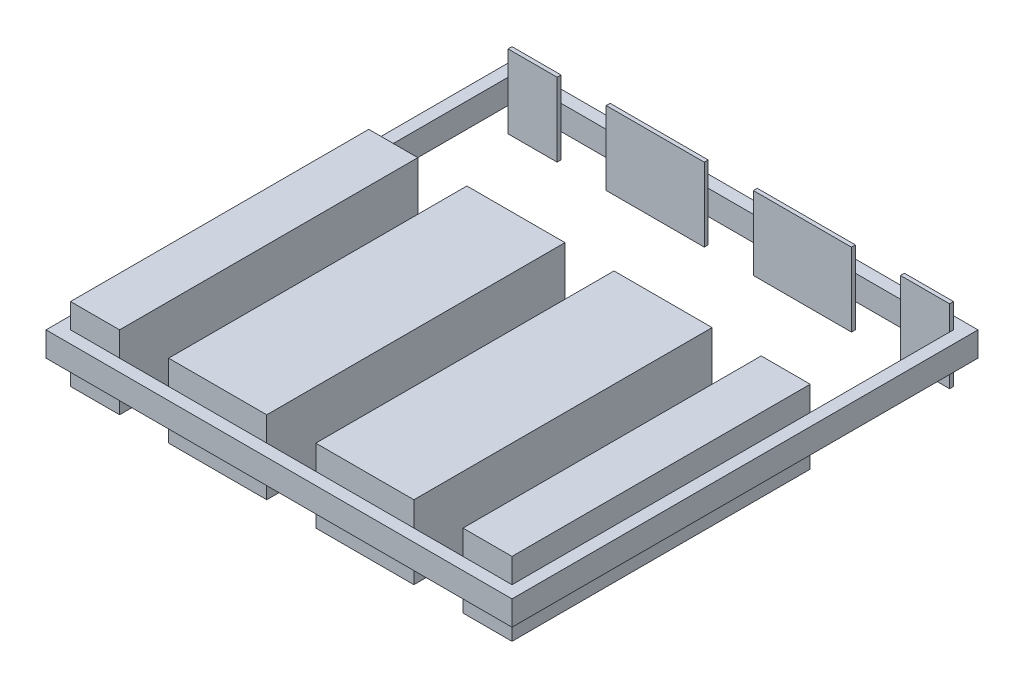
from build123d import *

# Parameters (mm, degrees)
SKETCH1_W           = 180
SKETCH1_H           = 30
BOSS_EXTRUDE1_DEPTH = 90
SKETCH2_W           = 20
SKETCH2_H           = 30
CUT_EXTRUDE1_DEPTH  = 90
CUT_EXTRUDE2_START  = -31.6
SKETCH3_OUTSIDE_W   = 233.264
SKETCH3_OUTSIDE_H   = 83.264
SKETCH3_OUTSIDE_W_2 = 16.8
SKETCH3_OUTSIDE_H_2 = 26.8
CUT_EXTRUDE2_DEPTH  = 56.8
SKETCH4_W           = 16.8
SKETCH4_H           = 26.8
CUT_EXTRUDE3_DEPTH  = 28.4
CUT_EXTRUDE4_START  = 31.6
SKETCH5_W           = 16.8
SKETCH5_H           = 26.8
CUT_EXTRUDE4_DEPTH  = 56.8
BOSS_EXTRUDE2_START = -31.6
SKETCH6_W           = 1.6
SKETCH6_H           = 23.8
BOSS_EXTRUDE2_DEPTH = 56.8
SKETCH7_W           = 1.6
SKETCH7_H           = 23.8
BOSS_EXTRUDE3_DEPTH = 28.4
BOSS_EXTRUDE4_START = 31.6
SKETCH8_W           = 1.6
SKETCH8_H           = 23.8
BOSS_EXTRUDE4_DEPTH = 56.8
CUT_EXTRUDE5_START  = -31.6
SKETCH9_OUTSIDE_W   = 233.264
SKETCH9_OUTSIDE_H   = 83.264
SKETCH9_OUTSIDE_W_2 = 1.6
SKETCH9_OUTSIDE_H_2 = 3
CUT_EXTRUDE5_DEPTH  = 56.8
SKETCH10_W          = 1.6
SKETCH10_H          = 3
CUT_EXTRUDE6_DEPTH  = 28.4
CUT_EXTRUDE7_START  = 31.6
SKETCH11_W          = 1.6
SKETCH11_H          = 3
CUT_EXTRUDE7_DEPTH  = 56.8
SKETCH12_W          = 190
SKETCH12_H          = 190
SKETCH12_W_2        = 180
SKETCH12_H_2        = 180
BOSS_EXTRUDE5_DEPTH = 5


with BuildPart() as part:
    # Sketch1 → Boss-Extrude1 (new, symmetric)
    with BuildSketch(Plane.XY):
        Rectangle(SKETCH1_W, SKETCH1_H)
    extrude(amount=BOSS_EXTRUDE1_DEPTH, both=True)

    # Sketch2 → Cut-Extrude1 (cut, symmetric)
    with BuildSketch(Plane.XY):
        with Locations((-60, 0)):
            Rectangle(SKETCH2_W, SKETCH2_H)
        Rectangle(SKETCH2_W, SKETCH2_H)
        with Locations((60, 0)):
            Rectangle(SKETCH2_W, SKETCH2_H)
    extrude(amount=CUT_EXTRUDE1_DEPTH, both=True, mode=Mode.SUBTRACT)


with BuildPart() as cut_extrude1_piece_1:
    # of the separate pieces the step leaves, piece 1, a body of its own (cut_extrude1_pieces)
    add(part.part.solids().sort_by_distance((-50, -15, -90))[0])


with BuildPart() as cut_extrude1_piece_2:
    # of the separate pieces the step leaves, piece 2, a body of its own (cut_extrude1_pieces)
    add(part.part.solids().sort_by_distance((10, -15, -90))[0])


with BuildPart() as cut_extrude1_piece_3:
    # of the separate pieces the step leaves, piece 3, a body of its own (cut_extrude1_pieces)
    add(part.part.solids().sort_by_distance((-90, -15, 90))[0])


with BuildPart() as cut_extrude1_piece_4:
    # of the separate pieces the step leaves, piece 4, a body of its own (cut_extrude1_pieces)
    add(part.part.solids().sort_by_distance((70, -15, -90))[0])


with BuildPart() as cut_extrude2_tool:
    # Sketch3 outside → Cut-Extrude2 (new body)
    with BuildSketch(Plane.XY.offset(CUT_EXTRUDE2_START)):
        Rectangle(SKETCH3_OUTSIDE_W, SKETCH3_OUTSIDE_H)
        with Locations((-80, 0)):
            Rectangle(SKETCH3_OUTSIDE_W_2, SKETCH3_OUTSIDE_H_2, mode=Mode.SUBTRACT)
        with Locations((-40, 0)):
            Rectangle(SKETCH3_OUTSIDE_W_2, SKETCH3_OUTSIDE_H_2, mode=Mode.SUBTRACT)
        with Locations((-20, 0)):
            Rectangle(SKETCH3_OUTSIDE_W_2, SKETCH3_OUTSIDE_H_2, mode=Mode.SUBTRACT)
        with Locations((20, 0)):
            Rectangle(SKETCH3_OUTSIDE_W_2, SKETCH3_OUTSIDE_H_2, mode=Mode.SUBTRACT)
        with Locations((40, 0)):
            Rectangle(SKETCH3_OUTSIDE_W_2, SKETCH3_OUTSIDE_H_2, mode=Mode.SUBTRACT)
        with Locations((80, 0)):
            Rectangle(SKETCH3_OUTSIDE_W_2, SKETCH3_OUTSIDE_H_2, mode=Mode.SUBTRACT)
    extrude(amount=-CUT_EXTRUDE2_DEPTH)


with BuildPart() as cut_extrude1_piece_1_1:
    add(cut_extrude1_piece_1.part)

    # Cut-Extrude2: cut by cut_extrude2_tool
    add(cut_extrude2_tool.part, mode=Mode.SUBTRACT)


with BuildPart() as cut_extrude1_piece_2_1:
    add(cut_extrude1_piece_2.part)

    # Cut-Extrude2: cut by cut_extrude2_tool
    add(cut_extrude2_tool.part, mode=Mode.SUBTRACT)


with BuildPart() as cut_extrude1_piece_3_1:
    add(cut_extrude1_piece_3.part)

    # Cut-Extrude2: cut by cut_extrude2_tool
    add(cut_extrude2_tool.part, mode=Mode.SUBTRACT)


with BuildPart() as cut_extrude1_piece_4_1:
    add(cut_extrude1_piece_4.part)

    # Cut-Extrude2: cut by cut_extrude2_tool
    add(cut_extrude2_tool.part, mode=Mode.SUBTRACT)


with BuildPart() as cut_extrude3_tool:
    # Sketch4 → Cut-Extrude3 (new, symmetric)
    with BuildSketch(Plane.XY):
        with Locations((-80, 0)):
            Rectangle(SKETCH4_W, SKETCH4_H)
        with Locations((-40, 0)):
            Rectangle(SKETCH4_W, SKETCH4_H)
        with Locations((-20, 0)):
            Rectangle(SKETCH4_W, SKETCH4_H)
        with Locations((20, 0)):
            Rectangle(SKETCH4_W, SKETCH4_H)
        with Locations((40, 0)):
            Rectangle(SKETCH4_W, SKETCH4_H)
        with Locations((80, 0)):
            Rectangle(SKETCH4_W, SKETCH4_H)
    extrude(amount=CUT_EXTRUDE3_DEPTH, both=True)


with BuildPart() as cut_extrude1_piece_1_2:
    add(cut_extrude1_piece_1_1.part)

    # Cut-Extrude3: cut by cut_extrude3_tool
    add(cut_extrude3_tool.part, mode=Mode.SUBTRACT)


with BuildPart() as cut_extrude1_piece_2_2:
    add(cut_extrude1_piece_2_1.part)

    # Cut-Extrude3: cut by cut_extrude3_tool
    add(cut_extrude3_tool.part, mode=Mode.SUBTRACT)


with BuildPart() as cut_extrude1_piece_3_2:
    add(cut_extrude1_piece_3_1.part)

    # Cut-Extrude3: cut by cut_extrude3_tool
    add(cut_extrude3_tool.part, mode=Mode.SUBTRACT)


with BuildPart() as cut_extrude1_piece_4_2:
    add(cut_extrude1_piece_4_1.part)

    # Cut-Extrude3: cut by cut_extrude3_tool
    add(cut_extrude3_tool.part, mode=Mode.SUBTRACT)


with BuildPart() as cut_extrude4_tool:
    # Sketch5 → Cut-Extrude4 (new body)
    with BuildSketch(Plane.XY.offset(CUT_EXTRUDE4_START)):
        with Locations((-80, 0)):
            Rectangle(SKETCH5_W, SKETCH5_H)
        with Locations((-40, 0)):
            Rectangle(SKETCH5_W, SKETCH5_H)
        with Locations((-20, 0)):
            Rectangle(SKETCH5_W, SKETCH5_H)
        with Locations((20, 0)):
            Rectangle(SKETCH5_W, SKETCH5_H)
        with Locations((40, 0)):
            Rectangle(SKETCH5_W, SKETCH5_H)
        with Locations((80, 0)):
            Rectangle(SKETCH5_W, SKETCH5_H)
    extrude(amount=-CUT_EXTRUDE4_DEPTH)


with BuildPart() as cut_extrude1_piece_1_3:
    add(cut_extrude1_piece_1_2.part)

    # Cut-Extrude4: cut by cut_extrude4_tool
    add(cut_extrude4_tool.part, mode=Mode.SUBTRACT)



with BuildPart() as cut_extrude1_piece_2_3:
    add(cut_extrude1_piece_2_2.part)

    # Cut-Extrude4: cut by cut_extrude4_tool
    add(cut_extrude4_tool.part, mode=Mode.SUBTRACT)


with BuildPart() as cut_extrude1_piece_3_3:
    add(cut_extrude1_piece_3_2.part)

    # Cut-Extrude4: cut by cut_extrude4_tool
    add(cut_extrude4_tool.part, mode=Mode.SUBTRACT)


with BuildPart() as cut_extrude1_piece_4_3:
    add(cut_extrude1_piece_4_2.part)

    # Cut-Extrude4: cut by cut_extrude4_tool
    add(cut_extrude4_tool.part, mode=Mode.SUBTRACT)


with BuildPart() as cut_extrude1_piece_1_4:
    add(cut_extrude1_piece_1_3.part)

    add(cut_extrude1_piece_2_3.part)  # Boss-Extrude2 merges Cut-Extrude1 piece 2

    add(cut_extrude1_piece_3_3.part)  # Boss-Extrude2 merges Cut-Extrude1 piece 3

    add(cut_extrude1_piece_4_3.part)  # Boss-Extrude2 merges Cut-Extrude1 piece 4
    # Sketch6 → Boss-Extrude2 (add)
    with BuildSketch(Plane.XY.offset(BOSS_EXTRUDE2_START)):
        with Locations((-75.4, -1.5)):
            Rectangle(SKETCH6_W, SKETCH6_H)
        with Locations((-80, 1.5)):
            Rectangle(SKETCH6_W, SKETCH6_H)
        with Locations((-84.6, -1.5)):
            Rectangle(SKETCH6_W, SKETCH6_H)
        with Locations((-44.6, -1.5)):
            Rectangle(SKETCH6_W, SKETCH6_H)
        with Locations((-40, 1.5)):
            Rectangle(SKETCH6_W, SKETCH6_H)
        with Locations((-35.4, -1.5)):
            Rectangle(SKETCH6_W, SKETCH6_H)
        with Locations((-15.4, -1.5)):
            Rectangle(SKETCH6_W, SKETCH6_H)
        with Locations((-20, 1.5)):
            Rectangle(SKETCH6_W, SKETCH6_H)
        with Locations((-24.6, -1.5)):
            Rectangle(SKETCH6_W, SKETCH6_H)
        with Locations((15.4, -1.5)):
            Rectangle(SKETCH6_W, SKETCH6_H)
        with Locations((20, 1.5)):
            Rectangle(SKETCH6_W, SKETCH6_H)
        with Locations((24.6, -1.5)):
            Rectangle(SKETCH6_W, SKETCH6_H)
        with Locations((44.6, -1.5)):
            Rectangle(SKETCH6_W, SKETCH6_H)
        with Locations((40, 1.5)):
            Rectangle(SKETCH6_W, SKETCH6_H)
        with Locations((35.4, -1.5)):
            Rectangle(SKETCH6_W, SKETCH6_H)
        with Locations((75.4, -1.5)):
            Rectangle(SKETCH6_W, SKETCH6_H)
        with Locations((80, 1.5)):
            Rectangle(SKETCH6_W, SKETCH6_H)
        with Locations((84.6, -1.5)):
            Rectangle(SKETCH6_W, SKETCH6_H)
    extrude(amount=BOSS_EXTRUDE2_DEPTH)

    # Sketch7 → Boss-Extrude3 (add, symmetric)
    with BuildSketch(Plane.XY):
        with Locations((-75.4, -1.5)):
            Rectangle(SKETCH7_W, SKETCH7_H)
        with Locations((-80, 1.5)):
            Rectangle(SKETCH7_W, SKETCH7_H)
        with Locations((-84.6, -1.5)):
            Rectangle(SKETCH7_W, SKETCH7_H)
        with Locations((-44.6, -1.5)):
            Rectangle(SKETCH7_W, SKETCH7_H)
        with Locations((-40, 1.5)):
            Rectangle(SKETCH7_W, SKETCH7_H)
        with Locations((-35.4, -1.5)):
            Rectangle(SKETCH7_W, SKETCH7_H)
        with Locations((-15.4, -1.5)):
            Rectangle(SKETCH7_W, SKETCH7_H)
        with Locations((-20, 1.5)):
            Rectangle(SKETCH7_W, SKETCH7_H)
        with Locations((-24.6, -1.5)):
            Rectangle(SKETCH7_W, SKETCH7_H)
        with Locations((15.4, -1.5)):
            Rectangle(SKETCH7_W, SKETCH7_H)
        with Locations((20, 1.5)):
            Rectangle(SKETCH7_W, SKETCH7_H)
        with Locations((24.6, -1.5)):
            Rectangle(SKETCH7_W, SKETCH7_H)
        with Locations((44.6, -1.5)):
            Rectangle(SKETCH7_W, SKETCH7_H)
        with Locations((40, 1.5)):
            Rectangle(SKETCH7_W, SKETCH7_H)
        with Locations((35.4, -1.5)):
            Rectangle(SKETCH7_W, SKETCH7_H)
        with Locations((75.4, -1.5)):
            Rectangle(SKETCH7_W, SKETCH7_H)
        with Locations((80, 1.5)):
            Rectangle(SKETCH7_W, SKETCH7_H)
        with Locations((84.6, -1.5)):
            Rectangle(SKETCH7_W, SKETCH7_H)
    extrude(amount=BOSS_EXTRUDE3_DEPTH, both=True)

    # Sketch8 → Boss-Extrude4 (add)
    with BuildSketch(Plane.XY.offset(BOSS_EXTRUDE4_START)):
        with Locations((-75.4, -1.5)):
            Rectangle(SKETCH8_W, SKETCH8_H)
        with Locations((-80, 1.5)):
            Rectangle(SKETCH8_W, SKETCH8_H)
        with Locations((-84.6, -1.5)):
            Rectangle(SKETCH8_W, SKETCH8_H)
        with Locations((-44.6, -1.5)):
            Rectangle(SKETCH8_W, SKETCH8_H)
        with Locations((-40, 1.5)):
            Rectangle(SKETCH8_W, SKETCH8_H)
        with Locations((-35.4, -1.5)):
            Rectangle(SKETCH8_W, SKETCH8_H)
        with Locations((-15.4, -1.5)):
            Rectangle(SKETCH8_W, SKETCH8_H)
        with Locations((-20, 1.5)):
            Rectangle(SKETCH8_W, SKETCH8_H)
        with Locations((-24.6, -1.5)):
            Rectangle(SKETCH8_W, SKETCH8_H)
        with Locations((15.4, -1.5)):
            Rectangle(SKETCH8_W, SKETCH8_H)
        with Locations((20, 1.5)):
            Rectangle(SKETCH8_W, SKETCH8_H)
        with Locations((24.6, -1.5)):
            Rectangle(SKETCH8_W, SKETCH8_H)
        with Locations((44.6, -1.5)):
            Rectangle(SKETCH8_W, SKETCH8_H)
        with Locations((40, 1.5)):
            Rectangle(SKETCH8_W, SKETCH8_H)
        with Locations((35.4, -1.5)):
            Rectangle(SKETCH8_W, SKETCH8_H)
        with Locations((75.4, -1.5)):
            Rectangle(SKETCH8_W, SKETCH8_H)
        with Locations((80, 1.5)):
            Rectangle(SKETCH8_W, SKETCH8_H)
        with Locations((84.6, -1.5)):
            Rectangle(SKETCH8_W, SKETCH8_H)
    extrude(amount=BOSS_EXTRUDE4_DEPTH)

    # Sketch9 outside → Cut-Extrude5 (cut)
    with BuildSketch(Plane.XY.offset(CUT_EXTRUDE5_START)):
        Rectangle(SKETCH9_OUTSIDE_W, SKETCH9_OUTSIDE_H)
        with Locations((-70.8, -11.9)):
            Rectangle(SKETCH9_OUTSIDE_W_2, SKETCH9_OUTSIDE_H_2, mode=Mode.SUBTRACT)
        with Locations((-49.2, -11.9)):
            Rectangle(SKETCH9_OUTSIDE_W_2, SKETCH9_OUTSIDE_H_2, mode=Mode.SUBTRACT)
        with Locations((-10.8, -11.9)):
            Rectangle(SKETCH9_OUTSIDE_W_2, SKETCH9_OUTSIDE_H_2, mode=Mode.SUBTRACT)
        with Locations((10.8, -11.9)):
            Rectangle(SKETCH9_OUTSIDE_W_2, SKETCH9_OUTSIDE_H_2, mode=Mode.SUBTRACT)
        with Locations((49.2, -11.9)):
            Rectangle(SKETCH9_OUTSIDE_W_2, SKETCH9_OUTSIDE_H_2, mode=Mode.SUBTRACT)
        with Locations((70.8, -11.9)):
            Rectangle(SKETCH9_OUTSIDE_W_2, SKETCH9_OUTSIDE_H_2, mode=Mode.SUBTRACT)
    extrude(amount=-CUT_EXTRUDE5_DEPTH, mode=Mode.SUBTRACT)

    # Sketch10 → Cut-Extrude6 (cut, symmetric)
    with BuildSketch(Plane.XY):
        with Locations((-70.8, -11.9)):
            Rectangle(SKETCH10_W, SKETCH10_H)
        with Locations((-49.2, -11.9)):
            Rectangle(SKETCH10_W, SKETCH10_H)
        with Locations((-10.8, -11.9)):
            Rectangle(SKETCH10_W, SKETCH10_H)
        with Locations((10.8, -11.9)):
            Rectangle(SKETCH10_W, SKETCH10_H)
        with Locations((49.2, -11.9)):
            Rectangle(SKETCH10_W, SKETCH10_H)
        with Locations((70.8, -11.9)):
            Rectangle(SKETCH10_W, SKETCH10_H)
    extrude(amount=CUT_EXTRUDE6_DEPTH, both=True, mode=Mode.SUBTRACT)

    # Sketch11 → Cut-Extrude7 (cut)
    with BuildSketch(Plane.XY.offset(CUT_EXTRUDE7_START)):
        with Locations((-70.8, -11.9)):
            Rectangle(SKETCH11_W, SKETCH11_H)
        with Locations((-49.2, -11.9)):
            Rectangle(SKETCH11_W, SKETCH11_H)
        with Locations((-10.8, -11.9)):
            Rectangle(SKETCH11_W, SKETCH11_H)
        with Locations((10.8, -11.9)):
            Rectangle(SKETCH11_W, SKETCH11_H)
        with Locations((49.2, -11.9)):
            Rectangle(SKETCH11_W, SKETCH11_H)
        with Locations((70.8, -11.9)):
            Rectangle(SKETCH11_W, SKETCH11_H)
    extrude(amount=-CUT_EXTRUDE7_DEPTH, mode=Mode.SUBTRACT)

    # Sketch12 → Boss-Extrude5 (add, symmetric)
    with BuildSketch(Plane(origin=(0, 0, 0), x_dir=(1, 0, 0), z_dir=(0, 1, 0))):
        Rectangle(SKETCH12_W, SKETCH12_H)
        Rectangle(SKETCH12_W_2, SKETCH12_H_2, mode=Mode.SUBTRACT)
    extrude(amount=BOSS_EXTRUDE5_DEPTH, both=True)


solid = cut_extrude1_piece_1_4.part
